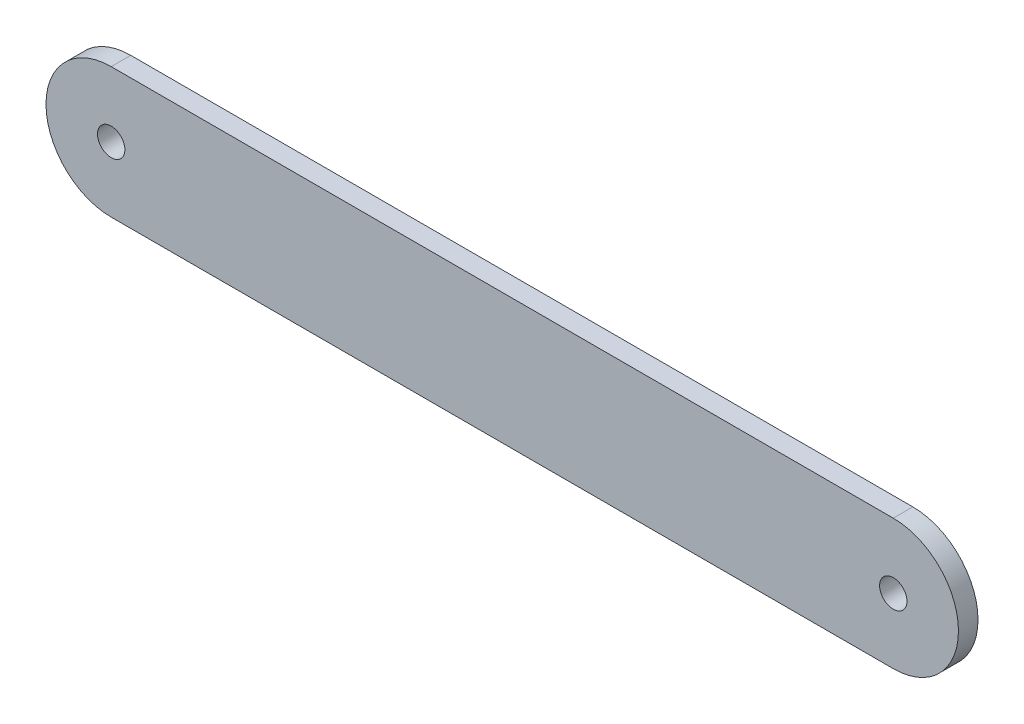
from build123d import *

# Parameters (mm, degrees)
SKETCH1_R           = 2.1
BOSS_EXTRUDE1_DEPTH = 3


with BuildPart() as part:
    # Sketch1 → Boss-Extrude1 (new body)
    with BuildSketch(Plane.XY):
        with BuildLine():
            Line((-60, 10), (60, 10))
            ThreePointArc((60, 10), (70, 0), (60, -10))
            Line((60, -10), (-60, -10))
            ThreePointArc((-60, -10), (-70, 0), (-60, 10))
        make_face()
        with Locations((-60, 0)):
            Circle(SKETCH1_R, mode=Mode.SUBTRACT)
        with Locations((60, 0)):
            Circle(SKETCH1_R, mode=Mode.SUBTRACT)
    extrude(amount=BOSS_EXTRUDE1_DEPTH)


solid = part.part
